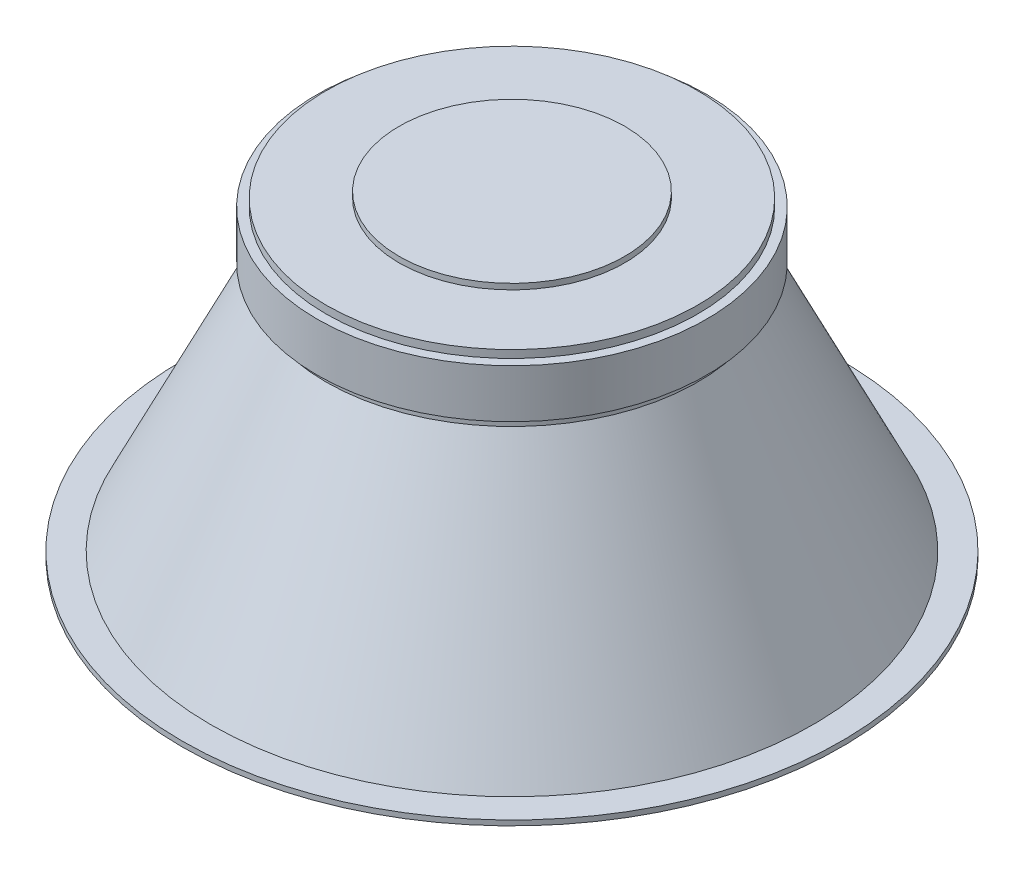
from build123d import *


with BuildPart() as part:
    # Sketch7 → Revolve1 (revolve)
    with BuildSketch(Plane(origin=(0, 0, 0), x_dir=(0, 0, -1), z_dir=(1, 0, 0))):
        with BuildLine():
            Line((12.574185856, 123.5), (-31.425814144, 123.5))
            Line((-31.425814144, 123.5), (-31.425814144, 121.283071523))
            Line((-31.425814144, 121.283071523), (-59.925814144, 121.283071523))
            Line((-59.925814144, 121.283071523), (-59.925814144, 118.279399969))
            Line((-59.925814144, 118.279399969), (-63.392753412, 118.279399969))
            Line((-63.392753412, 118.279399969), (-63.392753412, 99.360219559))
            Line((-63.392753412, 99.360219559), (-59.925814144, 99.360219559))
            Line((-59.925814144, 99.360219559), (-59.925814144, 95.283071523))
            Line((-59.925814144, 95.283071523), (-104.900814144, 2))
            Line((-104.900814144, 2), (-116.013314144, 2))
            Line((-116.013314144, 2), (-116.013314144, 0))
            Line((-116.013314144, 0), (-102.313314144, 0))
            Line((-102.313314144, 0), (-102.313314144, 2))
            Line((-102.313314144, 2), (-100.836707014, 3.46224088))
            Line((-100.836707014, 3.46224088), (-99.281451544, 2))
            Line((-99.281451544, 2), (-97.804844414, 3.46224088))
            Line((-97.804844414, 3.46224088), (-96.249588944, 2))
            Line((-96.249588944, 2), (-94.772981814, 3.46224088))
            Line((-94.772981814, 3.46224088), (-93.217726344, 2))
            Line((-93.217726344, 2), (-91.741119213, 3.46224088))
            Line((-91.741119213, 3.46224088), (-32.394348818, 54.139515502))
            ThreePointArc((-32.394348818, 54.139515502), (-11.042201343, 43.392393276), (12.574185856, 39.693597033))
            Line((12.574185856, 39.693597033), (12.574185856, 123.5))
        make_face()
    revolve(axis=Axis((0, 123.5, -12.574185856), (0, -1, 0)))


solid = part.part
